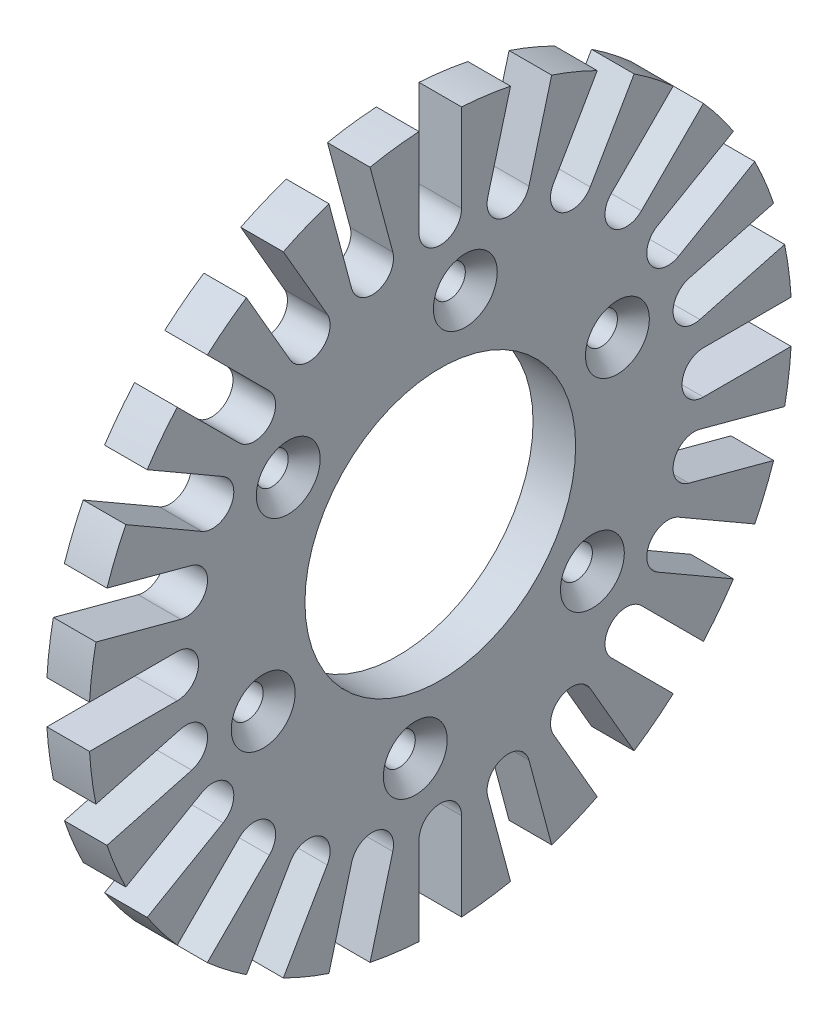
from build123d import *

# Parameters (mm, degrees)
SKETCH1_R                    = 33
BOSS_EXTRUDE1_DEPTH          = 4
CUT_EXTRUDE2_REACH           = 48.84
SKETCH3_R                    = 12.71
CUT_EXTRUDE3_REACH           = 48.84
CIRPATTERN2_COUNT            = 24
CUT_EXTRUDE1_REACH           = 48.755
SKETCH2_R                    = 1.5
CHAMFER1_SIZE                = 1.5
CIRPATTERN1_COUNT            = 6
CHAMFER1_OF_CIRPATTERN1_SIZE = 1.5


with BuildPart() as part:
    # Sketch1 → Boss-Extrude1 (new body)
    with BuildSketch(Plane(origin=(0, 0, 0), x_dir=(0, 0, -1), z_dir=(1, 0, 0))):
        Circle(SKETCH1_R)
    extrude(amount=BOSS_EXTRUDE1_DEPTH)

    # Sketch3 → Cut-Extrude2 (cut, up to next)
    with BuildSketch(Plane(origin=(4, 0, 0), x_dir=(0, 0, -1), z_dir=(1, 0, 0)), mode=Mode.PRIVATE) as cut_extrude2_sk1:
        Circle(SKETCH3_R)
    cut_extrude2_tool1 = extrude(cut_extrude2_sk1.sketch, amount=-CUT_EXTRUDE2_REACH, mode=Mode.PRIVATE) & part.part
    add(cut_extrude2_tool1.solids().sort_by_distance((4, 0, 0))[0], mode=Mode.SUBTRACT)

    # Sketch4 → Cut-Extrude3 (cut, up to next)
    with BuildSketch(Plane(origin=(4, 0, 0), x_dir=(0, 0, -1), z_dir=(1, 0, 0)), mode=Mode.PRIVATE) as cut_extrude3_sk1:
        with BuildLine():
            Line((-2, 33), (-2, 24.7))
            ThreePointArc((-2, 24.7), (0, 22.7), (2, 24.7))
            Line((2, 24.7), (2, 33))
            Line((2, 33), (-2, 33))
        make_face()
    cut_extrude3_tool1 = extrude(cut_extrude3_sk1.sketch, amount=-CUT_EXTRUDE3_REACH, mode=Mode.PRIVATE) & part.part
    cut_extrude3 = cut_extrude3_tool1.solids().sort_by_distance((4, 28.054508, 0))[0]
    add(cut_extrude3, mode=Mode.SUBTRACT)

    # CirPattern2: Cut-Extrude3 ×24 about axis
    cirpattern2_axis = Axis((4, 0, 0), (1, 0, 0))
    for i in range(1, CIRPATTERN2_COUNT):
        add(cut_extrude3.rotate(cirpattern2_axis, i * 360 / CIRPATTERN2_COUNT), mode=Mode.SUBTRACT)

    # Sketch2 → Cut-Extrude1 (cut, up to next)
    with BuildSketch(Plane(origin=(4, 0, 0), x_dir=(0, 0, -1), z_dir=(1, 0, 0)), mode=Mode.PRIVATE) as cut_extrude1_sk1:
        with Locations((2.34947146, 17.846007505)):
            Circle(SKETCH2_R)
    cut_extrude1_tool1 = extrude(cut_extrude1_sk1.sketch, amount=-CUT_EXTRUDE1_REACH, mode=Mode.PRIVATE) & part.part
    cut_extrude1 = cut_extrude1_tool1.solids().sort_by_distance((4, 17.846008, -2.349471))[0]
    add(cut_extrude1, mode=Mode.SUBTRACT)

    # Chamfer1
    chamfer1_edges = [part.edges().sort_by_distance(p)[0] for p in [
        (4, 17.846007505, -0.84947146),
    ]]
    chamfer(chamfer1_edges, length=CHAMFER1_SIZE)

    # CirPattern1: Cut-Extrude1 ×6 about axis
    cirpattern1_axis = Axis((4, 0, 0), (1, 0, 0))
    for i in range(1, CIRPATTERN1_COUNT):
        add(cut_extrude1.rotate(cirpattern1_axis, i * 360 / CIRPATTERN1_COUNT), mode=Mode.SUBTRACT)

    # Chamfer1 of CirPattern1
    chamfer1_of_cirpattern1_edges = [part.edges().sort_by_distance(p)[0] for p in [
        (4, 9.658667616, 15.030360125),
        (4, -8.187339888, 15.879831585),
        (4, -17.846007505, 0.84947146),
        (4, -9.658667616, -15.030360125),
        (4, 8.187339888, -15.879831585),
    ]]
    chamfer(chamfer1_of_cirpattern1_edges, length=CHAMFER1_OF_CIRPATTERN1_SIZE)


solid = part.part
